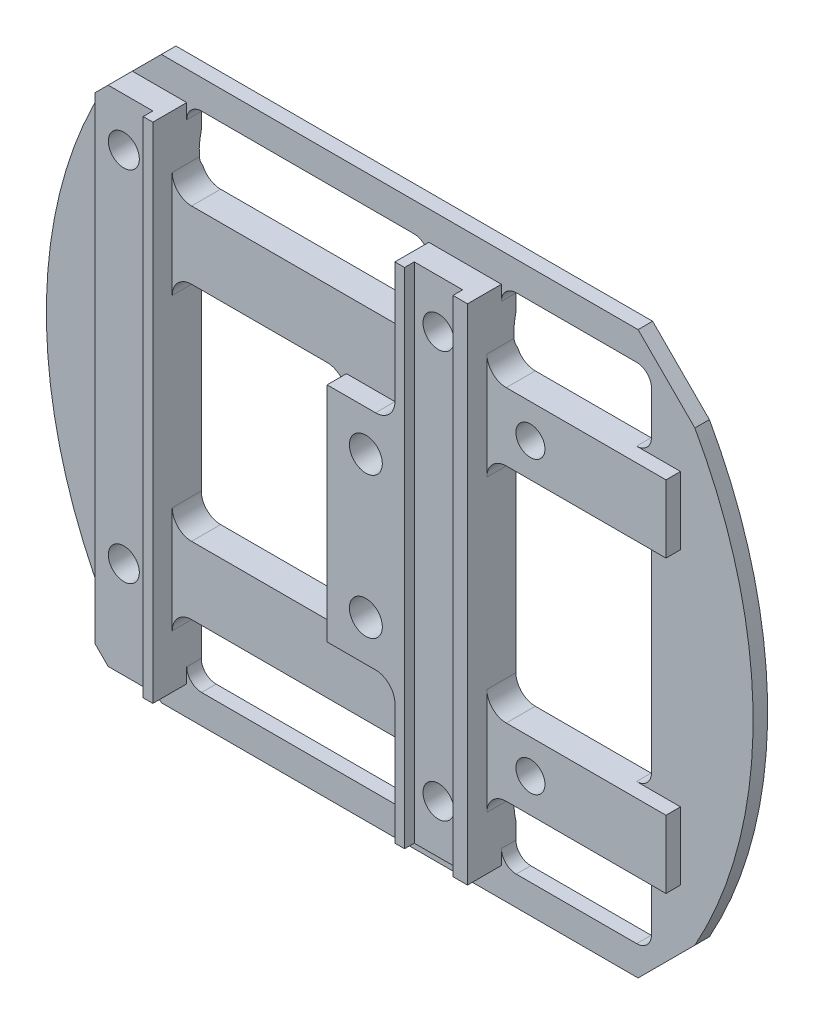
from build123d import *

# Parameters (mm, degrees)
SKETCH_1_W             = 58
SKETCH_1_H             = 58
SKETCH_1_R             = 1.6
SKETCH_1_R_2           = 1.5
SKETCH_1_R_3           = 1.7
EXTRUDE_1_DEPTH        = 5
CUT_EXTRUDE_1_DEPTH    = 3.5
SKETCH_3_W             = 25
SKETCH_3_H             = 7
SKETCH_3_R             = 1.5
EXTRUDE_2_DEPTH        = 1.5
FILLET_2_R             = 2
FILLET_3_R             = 2
CUT_EXTRUDE_2_REACH    = 64.378
SKETCH_4_W             = 5
SKETCH_4_H             = 1
EXTRUDE_6_DEPTH        = 1.5
PATTERN_LINEAR_1_COUNT = 2
PATTERN_LINEAR_1_PITCH = 37
PATTERN_LINEAR_2_COUNT = 2
PATTERN_LINEAR_2_PITCH = 32.5
FILLET_4_R             = 2
SKETCH_13_R            = 50.455920179
CUT_EXTRUDE_4_DEPTH    = 7
CHAMFER_1_SIZE         = 2
CHAMFER_2_SIZE         = 2


with BuildPart() as part:
    # 草图1 → 凸台-拉伸1 (new body)
    with BuildSketch(Plane.XY):
        Rectangle(SKETCH_1_W, SKETCH_1_H)
        with Locations((-26, 21)):
            Circle(SKETCH_1_R, mode=Mode.SUBTRACT)
        with Locations((-26, -16)):
            Circle(SKETCH_1_R, mode=Mode.SUBTRACT)
        with Locations((-15, 15)):
            Circle(SKETCH_1_R_2, mode=Mode.SUBTRACT)
        with Locations((6.5, 21)):
            Circle(SKETCH_1_R, mode=Mode.SUBTRACT)
        with Locations((15, 15)):
            Circle(SKETCH_1_R_2, mode=Mode.SUBTRACT)
        with Locations((0, 7.3)):
            Circle(SKETCH_1_R_3, mode=Mode.SUBTRACT)
        with Locations(Location((15, -15, 0), (0, 0, 180))):
            Circle(SKETCH_1_R_2, mode=Mode.SUBTRACT)
        with Locations(Location((6.5, -21, 0), (0, 0, 180))):
            Circle(SKETCH_1_R, mode=Mode.SUBTRACT)
        with Locations(Location((-15, -15, 0), (0, 0, 180))):
            Circle(SKETCH_1_R_2, mode=Mode.SUBTRACT)
        with Locations(Location((0, -7.3, 0), (0, 0, 180))):
            Circle(SKETCH_1_R_3, mode=Mode.SUBTRACT)
        with BuildLine():
            Line((12.033826763, 26), (24.466173237, 26))
            ThreePointArc((24.466173237, 26), (25.550752542, 25.550752542), (26, 24.466173237))
            Line((26, 24.466173237), (26, 20.033826763))
            ThreePointArc((26, 20.033826763), (25.550752542, 18.949247458), (24.466173237, 18.5))
            Line((24.466173237, 18.5), (12.033826763, 18.5))
            ThreePointArc((12.033826763, 18.5), (10.949247458, 18.949247458), (10.5, 20.033826763))
            Line((10.5, 20.033826763), (10.5, 24.466173237))
            ThreePointArc((10.5, 24.466173237), (10.949247458, 25.550752542), (12.033826763, 26))
        make_face(mode=Mode.SUBTRACT)
        with BuildLine():
            Line((12.033826763, 11.5), (24.466173237, 11.5))
            ThreePointArc((24.466173237, 11.5), (25.550752542, 11.050752542), (26, 9.966173237))
            Line((26, 9.966173237), (26, -9.966173237))
            ThreePointArc((26, -9.966173237), (25.550752542, -11.050752542), (24.466173237, -11.5))
            Line((24.466173237, -11.5), (12.033826763, -11.5))
            ThreePointArc((12.033826763, -11.5), (10.949247458, -11.050752542), (10.5, -9.966173237))
            Line((10.5, -9.966173237), (10.5, 9.966173237))
            ThreePointArc((10.5, 9.966173237), (10.949247458, 11.050752542), (12.033826763, 11.5))
        make_face(mode=Mode.SUBTRACT)
        with BuildLine():
            Line((12.033826763, -18.5), (24.466173237, -18.5))
            ThreePointArc((24.466173237, -18.5), (25.550752542, -18.949247458), (26, -20.033826763))
            Line((26, -20.033826763), (26, -24.466173237))
            ThreePointArc((26, -24.466173237), (25.550752542, -25.550752542), (24.466173237, -26))
            Line((24.466173237, -26), (12.033826763, -26))
            ThreePointArc((12.033826763, -26), (10.949247458, -25.550752542), (10.5, -24.466173237))
            Line((10.5, -24.466173237), (10.5, -20.033826763))
            ThreePointArc((10.5, -20.033826763), (10.949247458, -18.949247458), (12.033826763, -18.5))
        make_face(mode=Mode.SUBTRACT)
        with BuildLine():
            Line((-20.466173237, 26), (1.466173237, 26))
            ThreePointArc((1.466173237, 26), (2.550752542, 25.550752542), (3, 24.466173237))
            Line((3, 24.466173237), (3, 20.033826763))
            ThreePointArc((3, 20.033826763), (2.550752542, 18.949247458), (1.466173237, 18.5))
            Line((1.466173237, 18.5), (-20.466173237, 18.5))
            ThreePointArc((-20.466173237, 18.5), (-21.550752542, 18.949247458), (-22, 20.033826763))
            Line((-22, 20.033826763), (-22, 24.466173237))
            ThreePointArc((-22, 24.466173237), (-21.550752542, 25.550752542), (-20.466173237, 26))
        make_face(mode=Mode.SUBTRACT)
        with BuildLine():
            Line((-20.466173237, 11.5), (-5.533826763, 11.5))
            ThreePointArc((-5.533826763, 11.5), (-4.449247458, 11.050752542), (-4, 9.966173237))
            Line((-4, 9.966173237), (-4, -9.966173237))
            ThreePointArc((-4, -9.966173237), (-4.449247458, -11.050752542), (-5.533826763, -11.5))
            Line((-5.533826763, -11.5), (-20.466173237, -11.5))
            ThreePointArc((-20.466173237, -11.5), (-21.550752542, -11.050752542), (-22, -9.966173237))
            Line((-22, -9.966173237), (-22, 9.966173237))
            ThreePointArc((-22, 9.966173237), (-21.550752542, 11.050752542), (-20.466173237, 11.5))
        make_face(mode=Mode.SUBTRACT)
        with BuildLine():
            Line((-20.466173237, -18.5), (1.466173237, -18.5))
            ThreePointArc((1.466173237, -18.5), (2.550752542, -18.949247458), (3, -20.033826763))
            Line((3, -20.033826763), (3, -24.466173237))
            ThreePointArc((3, -24.466173237), (2.550752542, -25.550752542), (1.466173237, -26))
            Line((1.466173237, -26), (-20.466173237, -26))
            ThreePointArc((-20.466173237, -26), (-21.550752542, -25.550752542), (-22, -24.466173237))
            Line((-22, -24.466173237), (-22, -20.033826763))
            ThreePointArc((-22, -20.033826763), (-21.550752542, -18.949247458), (-20.466173237, -18.5))
        make_face(mode=Mode.SUBTRACT)
    extrude(amount=EXTRUDE_1_DEPTH)

    # 草图2 → 切除-拉伸1 (cut)
    with BuildSketch(Plane.XY.offset(5)):
        Polygon((-29, -26), (-29, -29), (29, -29), (29, 29), (-29, 29), (-29, 26), (-22, 26), (-22, -26), align=None)
        Polygon((10.5, 18.5), (10.5, 26), (3, 26), (3, 11.5), (-4, 11.5), (-4, -8.612951593), (-4, -11.5), (3, -11.5), (3, -26), (10.5, -26), (10.5, -18.5), align=None, mode=Mode.SUBTRACT)
    extrude(amount=-CUT_EXTRUDE_1_DEPTH, mode=Mode.SUBTRACT)

    # 草图3 → 凸台-拉伸2 (add)
    # profile 1 of 4: a face of its own
    with BuildSketch(Plane.XY.offset(1.5)):
        with Locations((-9.5, -15)):
            Rectangle(SKETCH_3_W, SKETCH_3_H)
    # profile 2 of 4: a face of its own
    with BuildSketch(Plane.XY.offset(1.5)):
        Polygon((-22, 18.5), (1.466173237, 18.5), (3, 18.5), (3, 11.5), (-22, 11.5), align=None)
    # profile 3 of 4: a face of its own
    with BuildSketch(Plane.XY.offset(1.5)):
        Polygon((24.466173237, 18.5), (12.033826763, 18.5), (10.5, 18.5), (10.5, 11.5), (12.033826763, 11.5), (24.466173237, 11.5), (29, 11.5), (29, 18.5), align=None)
        with Locations((15, 15)):
            Circle(SKETCH_3_R, mode=Mode.SUBTRACT)
    # profile 4 of 4: a face of its own
    with BuildSketch(Plane.XY.offset(1.5)):
        Polygon((29, -18.5), (29, -11.5), (24.466173237, -11.5), (12.033826763, -11.5), (10.5, -11.5), (10.5, -18.5), (12.033826763, -18.5), (24.466173237, -18.5), align=None)
        with Locations(Location((15, -15, 0), (0, 0, 180))):
            Circle(SKETCH_3_R, mode=Mode.SUBTRACT)
    extrude(amount=EXTRUDE_2_DEPTH)

    # 圆角2
    fillet_2_edges = [part.edges().sort_by_distance(p)[0] for p in [
        (-22, -11.5, 2.25),
    ]]
    fillet(fillet_2_edges, radius=FILLET_2_R)

    # 圆角3
    fillet_3_edges = [part.edges().sort_by_distance(p)[0] for p in [
        (10.5, 11.5, 2.25),
        (-22, 11.5, 2.25),
        (-4, 11.5, 2.25),
        (-22, -18.5, 2.25),
        (3, -18.5, 2.25),
        (10.5, -18.5, 2.25),
        (10.5, -11.5, 2.25),
        (10.5, 18.5, 2.25),
        (-22, 18.5, 2.25),
        (3, 18.5, 2.25),
        (-4, -11.5, 2.25),
    ]]
    fillet(fillet_3_edges, radius=FILLET_3_R)

    # 切除-拉伸2: up to this face of the body (flat: up to its plane)
    cut_extrude_2_end = Plane(part.part.faces().sort_by_distance((-25.5, 26, 3.25))[0])
    # 草图4 → 切除-拉伸2 (cut, up to the picked face)
    with BuildSketch(Plane.XZ.offset(26), mode=Mode.PRIVATE) as cut_extrude_2_sk1:
        Polygon((-28, 4), (-23, 4), (-23, 5), (-28, 5), (-29, 5), (-29, 4), align=None)
    cut_extrude_2_tool1 = split(extrude(cut_extrude_2_sk1.sketch, amount=-CUT_EXTRUDE_2_REACH, mode=Mode.PRIVATE), bisect_by=cut_extrude_2_end, keep=Keep.BOTH, mode=Mode.PRIVATE)
    # 草图4 → 切除-拉伸2 (cut, up to the picked face)
    with BuildSketch(Plane.XZ.offset(26), mode=Mode.PRIVATE) as cut_extrude_2_sk2:
        with Locations((6.5, 4.5)):
            Rectangle(SKETCH_4_W, SKETCH_4_H)
    cut_extrude_2_tool2 = split(extrude(cut_extrude_2_sk2.sketch, amount=-CUT_EXTRUDE_2_REACH, mode=Mode.PRIVATE), bisect_by=cut_extrude_2_end, keep=Keep.BOTH, mode=Mode.PRIVATE)
    add(cut_extrude_2_tool1.solids().sort_by(Axis((-26, -26, 4.5), (0, 1, 0)))[0], mode=Mode.SUBTRACT)
    add(cut_extrude_2_tool2.solids().sort_by(Axis((6.5, -26, 4.5), (0, 1, 0)))[0], mode=Mode.SUBTRACT)

    # 草图12 → 凸台-拉伸6 (add)
    with BuildSketch(Plane(origin=(0, 0, 0), x_dir=(-1, 0, 0), z_dir=(0, 0, -1))):
        with BuildLine():
            Line((29, 25.617376915), (29, -25.617376915))
            ThreePointArc((29, -25.617376915), (36.5, 0), (29, 25.617376915))
        make_face()
        with BuildLine():
            Line((-29, 25.617376915), (-29, -25.617376915))
            ThreePointArc((-29, -25.617376915), (-36.5, 0), (-29, 25.617376915))
        make_face()
    extrude(amount=-EXTRUDE_6_DEPTH)

    # 草图5 → 切除-旋转1 (revolve, cut)
    with BuildSketch(Plane.ZY.offset(26), mode=Mode.PRIVATE) as cut_revolve_1_sk:
        Polygon((1.6, 21), (1.6, 22.6), (0, 25.371281292), (0, 21), align=None)
    cut_revolve_1 = revolve(cut_revolve_1_sk.sketch.rotate(Axis((-26, 21, 0), (0, 0, 1)), 90), axis=Axis((-26, 21, 0), (0, 0, 1)), mode=Mode.SUBTRACT)

    # 阵列(线性)1: 切除-旋转1 ×2
    with Locations(*[(0, -i * PATTERN_LINEAR_1_PITCH, 0) for i in range(1, PATTERN_LINEAR_1_COUNT)]):
        add(cut_revolve_1, mode=Mode.SUBTRACT)

    # 阵列(线性)2: 切除-旋转1 ×2
    with Locations(*[(i * PATTERN_LINEAR_2_PITCH, 0, 0) for i in range(1, PATTERN_LINEAR_2_COUNT)]):
        add(cut_revolve_1, mode=Mode.SUBTRACT)

    # 草图6 → 切除-旋转2 (revolve, cut)
    with BuildSketch(Plane(origin=(6.5, 0, 0), x_dir=(0, 0, -1), z_dir=(1, 0, 0)), mode=Mode.PRIVATE) as cut_revolve_2_sk:
        Polygon((0, -21), (-1.6, -21), (-1.6, -22.6), (0, -25.371281292), align=None)
    revolve(cut_revolve_2_sk.sketch.rotate(Axis((6.5, -21, 0), (0, 0, 1)), 270), axis=Axis((6.5, -21, 0), (0, 0, 1)), mode=Mode.SUBTRACT)

    # 圆角4
    fillet_4_edges = [part.edges().sort_by_distance(p)[0] for p in [
        (3, -11.5, 4),
        (3, 11.5, 4),
    ]]
    fillet(fillet_4_edges, radius=FILLET_4_R)

    # 草图13 → 切除-拉伸4 (cut)
    with BuildSketch(Plane(origin=(0, 0, 0), x_dir=(-1, 0, 0), z_dir=(0, 0, -1))):
        Circle(SKETCH_13_R)
        with BuildLine():
            ThreePointArc((0, -46.208765402), (36.5, 0), (0, 46.208765402))
            ThreePointArc((0, 46.208765402), (-36.5, 0), (0, -46.208765402))
        make_face(mode=Mode.SUBTRACT)
    extrude(amount=-CUT_EXTRUDE_4_DEPTH, mode=Mode.SUBTRACT)

    # 倒角1
    # the kernel refuses this chamfer: 11.02112637, 2 mm, written as the material it takes off along each edge
    with BuildSketch(Plane(origin=(-26.619808612, 29, 20.143908505), x_dir=(1, 0, 0), z_dir=(0, 0, -1))) as chamfer_1_piece_1:
        with BuildLine():
            Line((CHAMFER_1_SIZE, 0), (-3.865883602, 5.865883602))
            ThreePointArc((-3.865883602, 5.865883602), (-2.160150245, 3.0422483), (0, 0))
            Line((0, 0), (CHAMFER_1_SIZE, 0))
        make_face()
    extrude(amount=38.787817011, mode=Mode.SUBTRACT)

    # 倒角2
    # the kernel refuses this chamfer: 11.02112637, 2 mm, written as the material it takes off along each edge
    with BuildSketch(Plane(origin=(-26.619808612, -29, 20.143908505), x_dir=(1, 0, 0), z_dir=(0, 0, -1)), Plane(origin=(26.619808612, 29, 20.143908505), x_dir=(-1, 0, 0), z_dir=(0, 0, -1))) as chamfer_2_piece_1:
        with BuildLine():
            Line((CHAMFER_2_SIZE, 0), (-3.865883602, -5.865883602))
            ThreePointArc((-3.865883602, -5.865883602), (-2.160150245, -3.0422483), (0, 0))
            Line((0, 0), (CHAMFER_2_SIZE, 0))
        make_face()
    extrude(amount=38.787817011, mode=Mode.SUBTRACT)
    with BuildSketch(Plane(origin=(26.619808612, -29, 20.143908505), x_dir=(0.5502868703985341, 0.8349756644759097, 0), z_dir=(0, 0, -1))) as chamfer_2_piece_2:
        with BuildLine():
            Line((7.025215047, 0), (-CHAMFER_2_SIZE * 0.550286870399, -CHAMFER_2_SIZE * 0.834975664476))
            Line((-CHAMFER_2_SIZE * 0.550286870399, -CHAMFER_2_SIZE * 0.834975664476), (0, 0))
            ThreePointArc((0, 0), (3.728905614, 0.12956359), (7.025215047, 0))
        make_face()
    extrude(amount=38.787817011, mode=Mode.SUBTRACT)


solid = part.part
